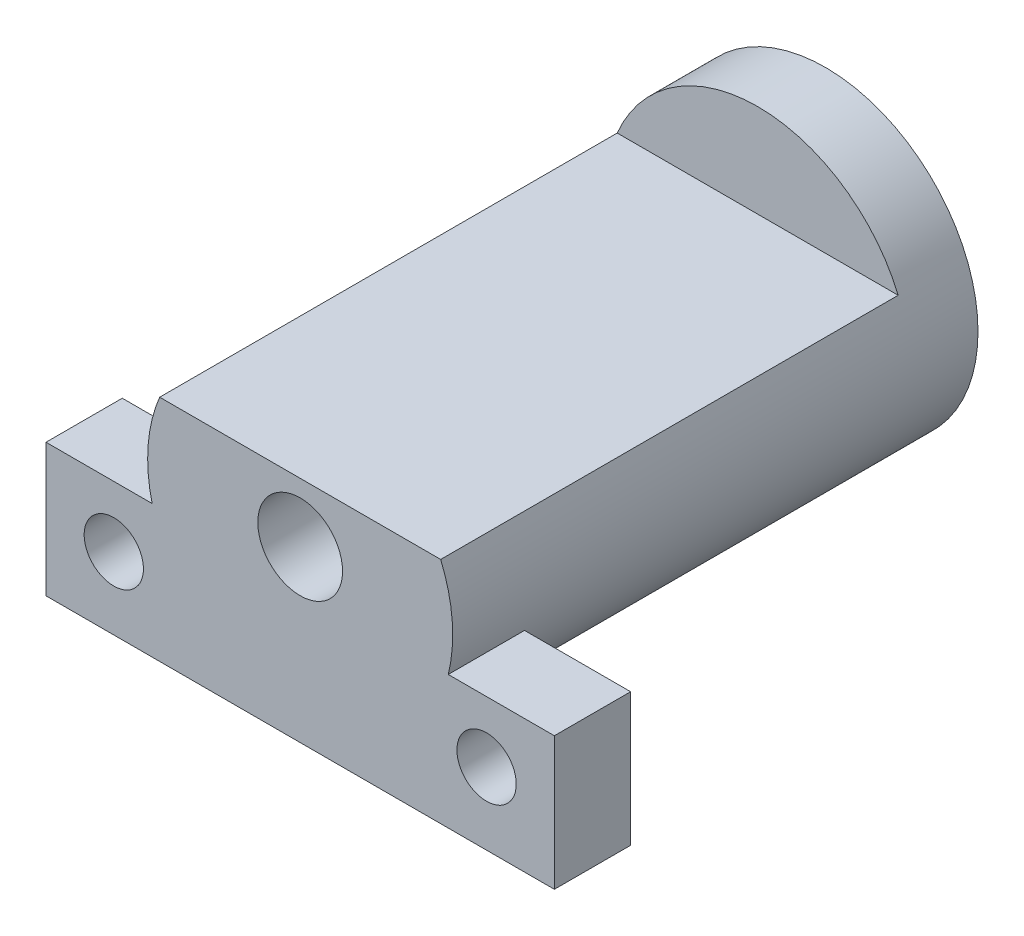
from build123d import *

# Parameters (mm, degrees)
SKETCH1_R           = 18
BOSS_EXTRUDE1_DEPTH = 62
SKETCH2_W           = 39.528935746
SKETCH2_H           = 14.130439677
CUT_EXTRUDE1_DEPTH  = 54
SKETCH3_W           = 60
SKETCH3_H           = 15.7
BOSS_EXTRUDE2_DEPTH = 9
SKETCH4_R           = 3.5
CUT_EXTRUDE2_DEPTH  = 10
LPATTERN1_COUNT     = 2
LPATTERN1_PITCH     = 44
SKETCH6_R           = 5
CUT_EXTRUDE3_DEPTH  = 100


with BuildPart() as part:
    # Sketch1 → Boss-Extrude1 (new body)
    with BuildSketch(Plane.XY):
        Circle(SKETCH1_R)
    extrude(amount=BOSS_EXTRUDE1_DEPTH)

    # Sketch2 → Cut-Extrude1 (cut)
    with BuildSketch(Plane.XY.offset(62)):
        with Locations((2.474682956, 14.065219839)):
            Rectangle(SKETCH2_W, SKETCH2_H)
    extrude(amount=-CUT_EXTRUDE1_DEPTH, mode=Mode.SUBTRACT)

    # Sketch3 → Boss-Extrude2 (add)
    with BuildSketch(Plane.XY.offset(62)):
        with Locations((0, -12.16286005)):
            Rectangle(SKETCH3_W, SKETCH3_H)
    extrude(amount=-BOSS_EXTRUDE2_DEPTH)

    # Sketch4 → Cut-Extrude2 (cut)
    with BuildSketch(Plane(origin=(0, 0, 53), x_dir=(-1, 0, 0), z_dir=(0, 0, -1))):
        with Locations((-22, -11.51286005)):
            Circle(SKETCH4_R)
    cut_extrude2 = extrude(amount=-CUT_EXTRUDE2_DEPTH, mode=Mode.SUBTRACT)

    # LPattern1: Cut-Extrude2 ×2
    with Locations(*[(-i * LPATTERN1_PITCH, 0, 0) for i in range(1, LPATTERN1_COUNT)]):
        add(cut_extrude2, mode=Mode.SUBTRACT)

    # Sketch6 → Cut-Extrude3 (cut)
    with BuildSketch(Plane(origin=(0, 0, 0), x_dir=(-1, 0, 0), z_dir=(0, 0, -1))):
        Circle(SKETCH6_R)
    extrude(amount=-CUT_EXTRUDE3_DEPTH, mode=Mode.SUBTRACT)


solid = part.part
